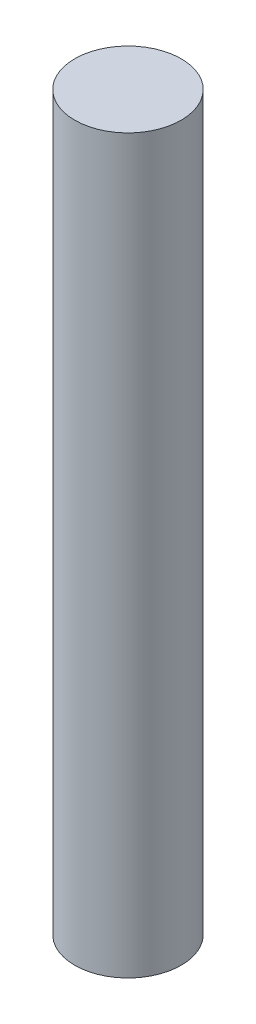
from build123d import *

# Parameters (mm, degrees)
SKETCH2_R           = 4
BOSS_EXTRUDE1_DEPTH = 55


with BuildPart() as part:
    # Sketch2 → Boss-Extrude1 (new body)
    with BuildSketch(Plane(origin=(0, 0, 0), x_dir=(1, 0, 0), z_dir=(0, 1, 0))):
        Circle(SKETCH2_R)
    extrude(amount=BOSS_EXTRUDE1_DEPTH)


solid = part.part
